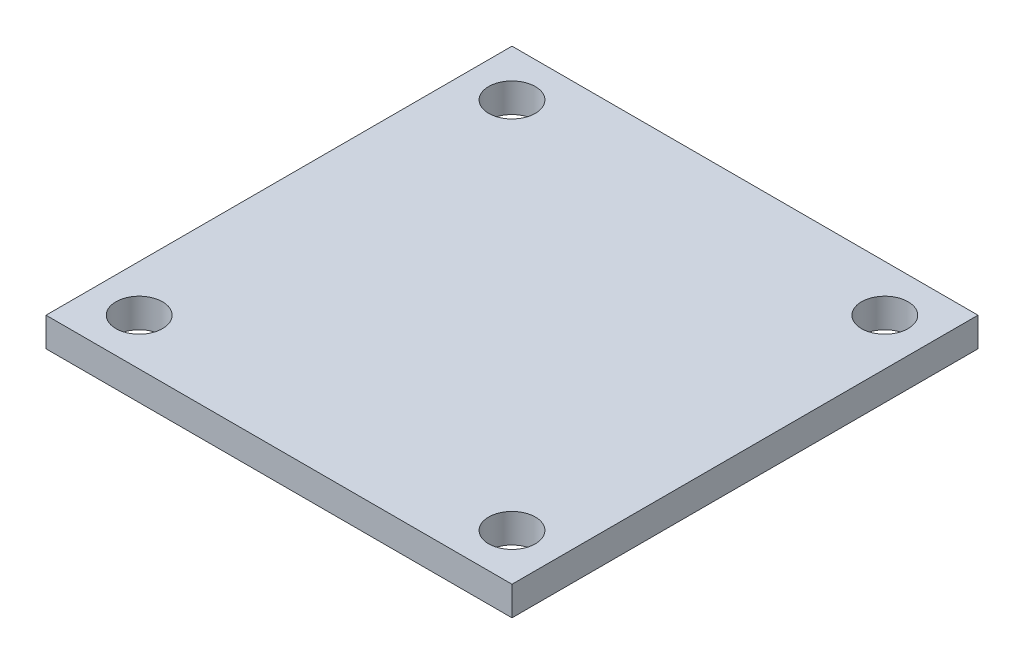
from build123d import *

# Parameters (mm, degrees)
ESBO_O1_W                 = 200
ESBO_O1_H                 = 200
RESSALTO_EXTRUS_O1_DEPTH  = 12.5
ESBO_O2_R                 = 10
CORTE_EXTRUS_O1_DEPTH     = 142.972708645
PADR_O_LINEAR1_COUNT      = 2
PADR_O_LINEAR1_PITCH      = 160
PADR_O_LINEAR1_COUNT_DIR2 = 2
PADR_O_LINEAR1_PITCH_DIR2 = 160


with BuildPart() as part:
    # Esboço1 → Ressalto-extrusão1 (new body)
    with BuildSketch(Plane(origin=(0, 0, 0), x_dir=(1, 0, 0), z_dir=(0, 1, 0))):
        Rectangle(ESBO_O1_W, ESBO_O1_H)
    extrude(amount=RESSALTO_EXTRUS_O1_DEPTH)

    # Esboço2 → Corte-extrusão1 (cut, through all)
    with BuildSketch(Plane(origin=(0, 12.5, 0), x_dir=(1, 0, 0), z_dir=(0, 1, 0))):
        with Locations((-80, 80)):
            Circle(ESBO_O2_R)
    corte_extrus_o1 = extrude(amount=-CORTE_EXTRUS_O1_DEPTH, mode=Mode.SUBTRACT)

    # Padrão linear1: Corte-extrus_o1 2 × 2
    with Locations(*[(i * PADR_O_LINEAR1_PITCH, 0, j * PADR_O_LINEAR1_PITCH_DIR2) for i in range(PADR_O_LINEAR1_COUNT) for j in range(PADR_O_LINEAR1_COUNT_DIR2) if (i, j) != (0, 0)]):
        add(corte_extrus_o1, mode=Mode.SUBTRACT)


solid = part.part
